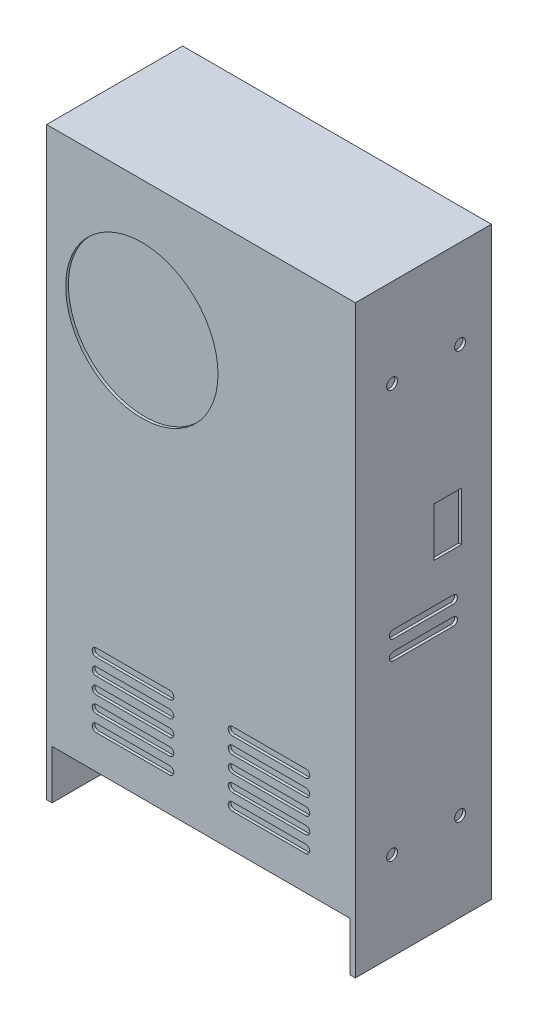
from build123d import *

# Parameters (mm, degrees)
SKETCH1_W                    = 113.5
SKETCH1_H                    = 215
BOSS_EXTRUDE1_DEPTH          = 50
CUT_EXTRUDE1_DEPTH           = 1
CUT_EXTRUDE2_DEPTH           = 1
CUT_EXTRUDE3_DEPTH           = 1
CUT_EXTRUDE4_DEPTH           = 1
CUT_EXTRUDE5_DEPTH           = 1
CUT_EXTRUDE6_DEPTH           = 1
CUT_EXTRUDE7_DEPTH           = 1
CUT_EXTRUDE8_DEPTH           = 1
CUT_EXTRUDE9_DEPTH           = 1
SKETCH11_W                   = 109.5
SKETCH11_H                   = 40
CUT_EXTRUDE10_DEPTH          = 18
CUT_EXTRUDE11_DEPTH          = 1
CUT_EXTRUDE12_DEPTH          = 1
SKETCH14_W                   = 10
SKETCH14_H                   = 18
CUT_EXTRUDE13_DEPTH          = 1
CUT_EXTRUDE14_DEPTH          = 1
F_4_0_4_DIAMETER_HOLE1_D     = 4
F_4_0_4_DIAMETER_HOLE1_DEPTH = 1
F_4_0_4_DIAMETER_HOLE2_D     = 4
F_4_0_4_DIAMETER_HOLE2_DEPTH = 1
F_4_0_4_DIAMETER_HOLE3_D     = 4
F_4_0_4_DIAMETER_HOLE3_DEPTH = 1
M48_CLEARANCE_HOLE1_D        = 56
M48_CLEARANCE_HOLE1_DEPTH    = 1
RIB1_START                   = -44
RIB1_OUTLINE_W               = 15
RIB1_OUTLINE_H               = 17
RIB1_DEPTH                   = 88


# Read off the part's stored shape, not the designer's step: Rib1
with BuildPart() as part:
    # Sketch1 → Boss-Extrude1 (new body)
    with BuildSketch(Plane.XY.offset(50)):
        with Locations((56.75, 107.5)):
            Rectangle(SKETCH1_W, SKETCH1_H)
    extrude(amount=-BOSS_EXTRUDE1_DEPTH)

    # Sketch2 → Cut-Extrude1 (cut)
    with BuildSketch(Plane.XY.offset(50)):
        with BuildLine():
            Line((18.25, 36.5), (45.25, 36.5))
            ThreePointArc((45.25, 36.5), (46.75, 38), (45.25, 39.5))
            Line((45.25, 39.5), (18.25, 39.5))
            ThreePointArc((18.25, 39.5), (16.75, 38), (18.25, 36.5))
        make_face()
    extrude(amount=-CUT_EXTRUDE1_DEPTH, mode=Mode.SUBTRACT)

    # Sketch3 → Cut-Extrude2 (cut)
    with BuildSketch(Plane.XY.offset(50)):
        with BuildLine():
            Line((18.25, 30.5), (45.25, 30.5))
            ThreePointArc((45.25, 30.5), (46.75, 32), (45.25, 33.5))
            Line((45.25, 33.5), (18.25, 33.5))
            ThreePointArc((18.25, 33.5), (16.75, 32), (18.25, 30.5))
        make_face()
    extrude(amount=-CUT_EXTRUDE2_DEPTH, mode=Mode.SUBTRACT)

    # Sketch4 → Cut-Extrude3 (cut)
    with BuildSketch(Plane.XY.offset(50)):
        with BuildLine():
            Line((18.25, 48.5), (45.25, 48.5))
            ThreePointArc((45.25, 48.5), (46.75, 50), (45.25, 51.5))
            Line((45.25, 51.5), (18.25, 51.5))
            ThreePointArc((18.25, 51.5), (16.75, 50), (18.25, 48.5))
        make_face()
    extrude(amount=-CUT_EXTRUDE3_DEPTH, mode=Mode.SUBTRACT)

    # Sketch5 → Cut-Extrude4 (cut)
    with BuildSketch(Plane.XY.offset(50)):
        with BuildLine():
            Line((18.25, 42.5), (45.25, 42.5))
            ThreePointArc((45.25, 42.5), (46.75, 44), (45.25, 45.5))
            Line((45.25, 45.5), (18.25, 45.5))
            ThreePointArc((18.25, 45.5), (16.75, 44), (18.25, 42.5))
        make_face()
    extrude(amount=-CUT_EXTRUDE4_DEPTH, mode=Mode.SUBTRACT)

    # Sketch6 → Cut-Extrude5 (cut)
    with BuildSketch(Plane.XY.offset(50)):
        with BuildLine():
            Line((68.25, 54.5), (95.25, 54.5))
            ThreePointArc((95.25, 54.5), (96.75, 56), (95.25, 57.5))
            Line((95.25, 57.5), (68.25, 57.5))
            ThreePointArc((68.25, 57.5), (66.75, 56), (68.25, 54.5))
        make_face()
    extrude(amount=-CUT_EXTRUDE5_DEPTH, mode=Mode.SUBTRACT)

    # Sketch7 → Cut-Extrude6 (cut)
    with BuildSketch(Plane.XY.offset(50)):
        with BuildLine():
            Line((18.25, 54.5), (45.25, 54.5))
            ThreePointArc((45.25, 54.5), (46.75, 56), (45.25, 57.5))
            Line((45.25, 57.5), (18.25, 57.5))
            ThreePointArc((18.25, 57.5), (16.75, 56), (18.25, 54.5))
        make_face()
    extrude(amount=-CUT_EXTRUDE6_DEPTH, mode=Mode.SUBTRACT)

    # Sketch8 → Cut-Extrude7 (cut)
    with BuildSketch(Plane.XY.offset(50)):
        with BuildLine():
            Line((68.25, 48.5), (95.25, 48.5))
            ThreePointArc((95.25, 48.5), (96.75, 50), (95.25, 51.5))
            Line((95.25, 51.5), (68.25, 51.5))
            ThreePointArc((68.25, 51.5), (66.75, 50), (68.25, 48.5))
        make_face()
    extrude(amount=-CUT_EXTRUDE7_DEPTH, mode=Mode.SUBTRACT)

    # Sketch9 → Cut-Extrude8 (cut)
    with BuildSketch(Plane.XY.offset(50)):
        with BuildLine():
            Line((68.25, 42.5), (95.25, 42.5))
            ThreePointArc((95.25, 42.5), (96.75, 44), (95.25, 45.5))
            Line((95.25, 45.5), (68.25, 45.5))
            ThreePointArc((68.25, 45.5), (66.75, 44), (68.25, 42.5))
        make_face()
    extrude(amount=-CUT_EXTRUDE8_DEPTH, mode=Mode.SUBTRACT)

    # Sketch10 → Cut-Extrude9 (cut)
    with BuildSketch(Plane.XY.offset(50)):
        with BuildLine():
            Line((68.25, 36.5), (95.25, 36.5))
            ThreePointArc((95.25, 36.5), (96.75, 38), (95.25, 39.5))
            Line((95.25, 39.5), (68.25, 39.5))
            ThreePointArc((68.25, 39.5), (66.75, 38), (68.25, 36.5))
        make_face()
    extrude(amount=-CUT_EXTRUDE9_DEPTH, mode=Mode.SUBTRACT)

    # Sketch11 → Cut-Extrude10 (cut)
    with BuildSketch(Plane.XZ):
        with Locations((56.75, 30)):
            Rectangle(SKETCH11_W, SKETCH11_H)
    extrude(amount=-CUT_EXTRUDE10_DEPTH, mode=Mode.SUBTRACT)

    # Sketch12 → Cut-Extrude11 (cut)
    with BuildSketch(Plane.XY.offset(50)):
        with BuildLine():
            Line((68.25, 30.5), (95.25, 30.5))
            ThreePointArc((95.25, 30.5), (96.75, 32), (95.25, 33.5))
            Line((95.25, 33.5), (68.25, 33.5))
            ThreePointArc((68.25, 33.5), (66.75, 32), (68.25, 30.5))
        make_face()
    extrude(amount=-CUT_EXTRUDE11_DEPTH, mode=Mode.SUBTRACT)

    # Sketch13 → Cut-Extrude12 (cut)
    with BuildSketch(Plane(origin=(113.5, 0, 0), x_dir=(0, 0, -1), z_dir=(1, 0, 0))):
        with BuildLine():
            Line((-36, 101), (-14, 101))
            ThreePointArc((-14, 101), (-12.5, 102.5), (-14, 104))
            Line((-14, 104), (-36, 104))
            ThreePointArc((-36, 104), (-37.5, 102.5), (-36, 101))
        make_face()
    extrude(amount=-CUT_EXTRUDE12_DEPTH, mode=Mode.SUBTRACT)

    # Sketch14 → Cut-Extrude13 (cut)
    with BuildSketch(Plane(origin=(113.5, 0, 0), x_dir=(0, 0, -1), z_dir=(1, 0, 0))):
        with Locations((-16, 127.5)):
            Rectangle(SKETCH14_W, SKETCH14_H)
    extrude(amount=-CUT_EXTRUDE13_DEPTH, mode=Mode.SUBTRACT)

    # Sketch15 → Cut-Extrude14 (cut)
    with BuildSketch(Plane(origin=(113.5, 0, 0), x_dir=(0, 0, -1), z_dir=(1, 0, 0))):
        with BuildLine():
            Line((-36, 94), (-14, 94))
            ThreePointArc((-14, 94), (-12.5, 95.5), (-14, 97))
            Line((-14, 97), (-36, 97))
            ThreePointArc((-36, 97), (-37.5, 95.5), (-36, 94))
        make_face()
    extrude(amount=-CUT_EXTRUDE14_DEPTH, mode=Mode.SUBTRACT)

    # Ø4.0 (4) Diameter Hole1
    with Locations(Plane(origin=(0, 0, 0), x_dir=(-1, 0, 0), z_dir=(0, 0, -1))):
        with Locations((-31.75, 182.5), (-81.75, 182.5), (-31.75, 32.5), (-81.75, 32.5)):
            Hole(F_4_0_4_DIAMETER_HOLE1_D / 2, depth=F_4_0_4_DIAMETER_HOLE1_DEPTH)

    # Ø4.0 (4) Diameter Hole2
    with Locations(Plane.ZY):
        with Locations((11.5, 32.5), (11.5, 182.5)):
            Hole(F_4_0_4_DIAMETER_HOLE2_D / 2, depth=F_4_0_4_DIAMETER_HOLE2_DEPTH)

    # Ø4.0 (4) Diameter Hole3
    with Locations(Plane(origin=(113.5, 0, 0), x_dir=(0, 0, -1), z_dir=(1, 0, 0))):
        with Locations((-36.5, 32.5), (-11.5, 32.5), (-36.5, 182.5), (-11.5, 182.5)):
            Hole(F_4_0_4_DIAMETER_HOLE3_D / 2, depth=F_4_0_4_DIAMETER_HOLE3_DEPTH)

    # M48 Clearance Hole1
    with Locations(Plane.XY.offset(50)):
        with Locations((35, 167)):
            Hole(M48_CLEARANCE_HOLE1_D / 2, depth=M48_CLEARANCE_HOLE1_DEPTH)

    # Rib1 outline → Rib1 (add)
    with BuildSketch(Plane(origin=(62.5, 0, 0), x_dir=(0, 0, -1), z_dir=(1, 0, 0)).offset(RIB1_START)):
        with Locations((-17.5, 9.5)):
            Rectangle(RIB1_OUTLINE_W, RIB1_OUTLINE_H)
    extrude(amount=RIB1_DEPTH)


solid = part.part
